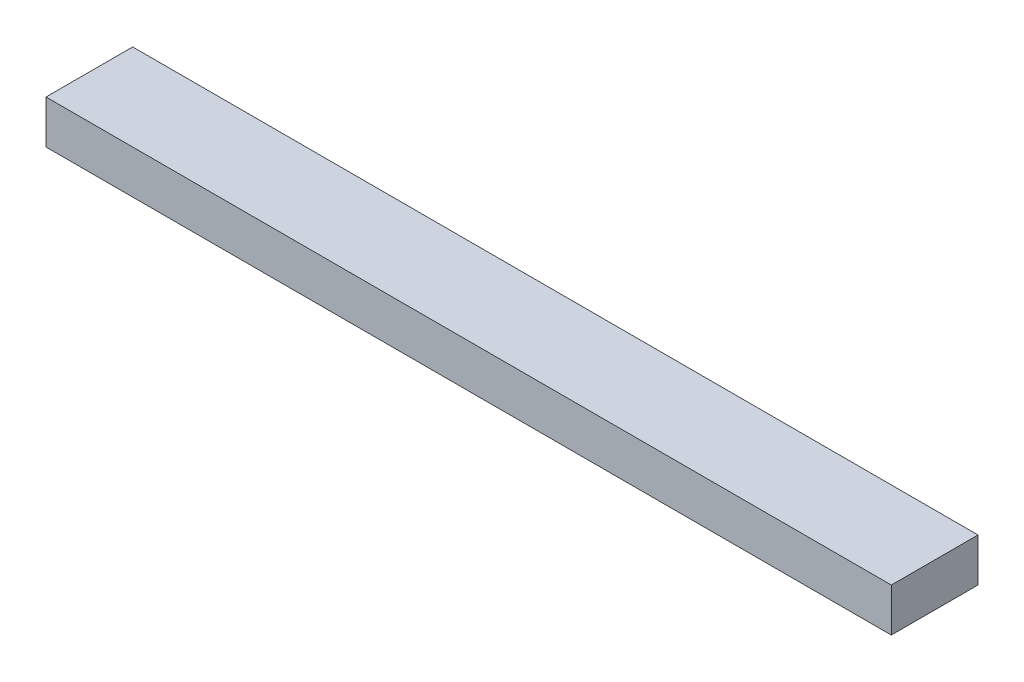
from build123d import *

# Parameters (mm, degrees)
SKETCH1_W           = 101.6
SKETCH1_H           = 50.8
BOSS_EXTRUDE1_DEPTH = 990.6


with BuildPart() as part:
    # Sketch1 → Boss-Extrude1 (new body)
    with BuildSketch(Plane(origin=(0, 0, 0), x_dir=(0, 0, -1), z_dir=(1, 0, 0))):
        with Locations((50.8, 25.4)):
            Rectangle(SKETCH1_W, SKETCH1_H)
    extrude(amount=BOSS_EXTRUDE1_DEPTH)


solid = part.part
